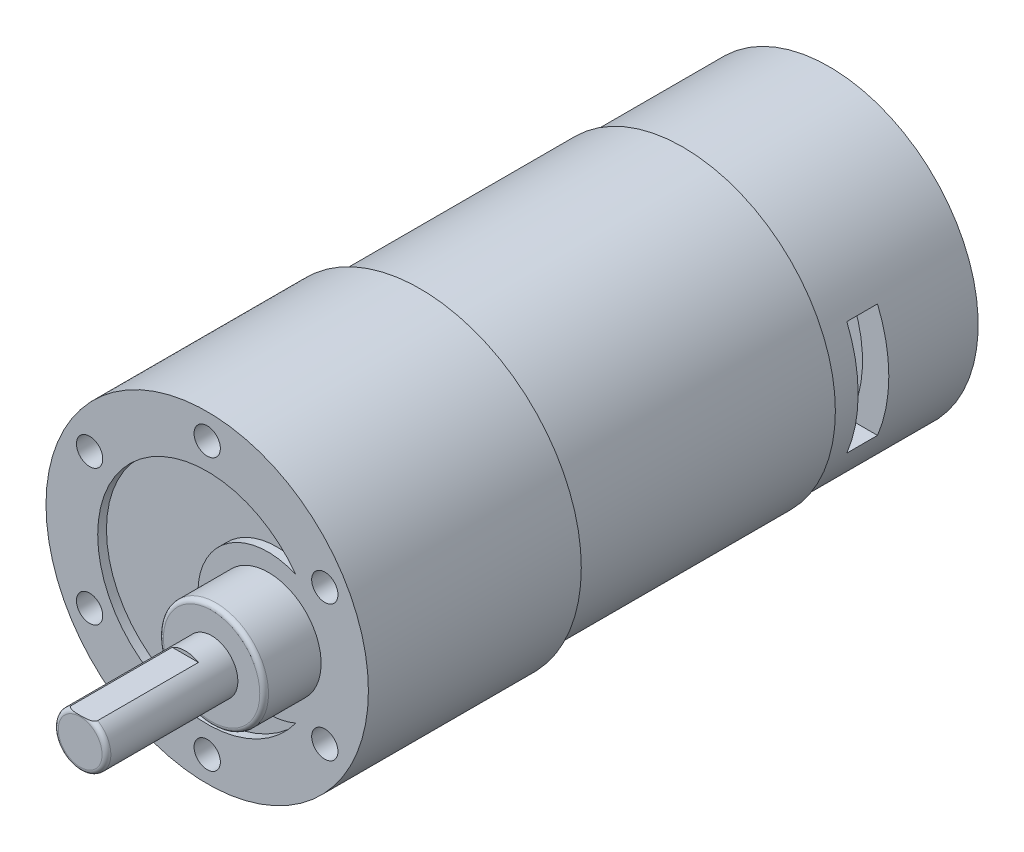
from build123d import *

# Parameters (mm, degrees)
SKETCH1_R                    = 18.4
BOSS_EXTRUDE1_DEPTH          = 24.3
SKETCH2_R                    = 17.4
BOSS_EXTRUDE2_DEPTH          = 30
SKETCH3_R                    = 6
BOSS_EXTRUDE3_DEPTH          = 6.5
FILLET1_R                    = 0.5
SKETCH4_R                    = 3
BOSS_EXTRUDE4_DEPTH          = 15
CUT_EXTRUDE1_START           = -12
CUT_EXTRUDE1_DEPTH           = 12
F_3_0_3_DIAMETER_HOLE1_D     = 3
F_3_0_3_DIAMETER_HOLE1_DEPTH = 3
F_3_0_3_DIAMETER_HOLE1_TIP   = 0.901290929
CUT_EXTRUDE2_DEPTH           = 1
SKETCH9_R                    = 4
BOSS_EXTRUDE5_DEPTH          = 1
FILLET2_R                    = 0.5
SKETCH10_R                   = 14
BOSS_EXTRUDE6_DEPTH          = 1.5
SKETCH11_W                   = 3.5
SKETCH11_H                   = 1
BOSS_EXTRUDE7_DEPTH          = 5.6
FILLET3_R                    = 0.5
SKETCH13_R                   = 9
BOSS_EXTRUDE8_DEPTH          = 3
SKETCH14_R                   = 1.5
BOSS_EXTRUDE9_DEPTH          = 8.55
FILLET4_R                    = 0.5
SKETCH15_W                   = 3
SKETCH15_H                   = 16.7
SKETCH16_R                   = 14
BOSS_EXTRUDE10_DEPTH         = 1
CUT_EXTRUDE3_START           = 12
SKETCH17_W                   = 3.5
SKETCH17_H                   = 13
CUT_EXTRUDE3_DEPTH           = 42.460359146


with BuildPart() as part:
    # Sketch1 → Boss-Extrude1 (new body)
    with BuildSketch(Plane.XY):
        Circle(SKETCH1_R)
    extrude(amount=BOSS_EXTRUDE1_DEPTH)

    # Sketch2 → Boss-Extrude2 (add)
    with BuildSketch(Plane(origin=(0, 0, 0), x_dir=(-1, 0, 0), z_dir=(0, 0, -1))):
        with Locations(Location((0, 0, 0), (0, 0, 180))):
            Circle(SKETCH2_R)
    extrude(amount=BOSS_EXTRUDE2_DEPTH)

    # Sketch3 → Boss-Extrude3 (add)
    with BuildSketch(Plane.XY.offset(24.3)):
        with Locations(Location((7, 0, 0), (0, 0, 180))):
            Circle(SKETCH3_R)
    extrude(amount=BOSS_EXTRUDE3_DEPTH)

    # Fillet1
    fillet1_edges = [part.edges().sort_by_distance(p)[0] for p in [
        (13, 0, 30.8),
    ]]
    fillet(fillet1_edges, radius=FILLET1_R)

    # Sketch4 → Boss-Extrude4 (add)
    with BuildSketch(Plane.XY.offset(30.8)):
        with Locations((7, 0)):
            Circle(SKETCH4_R)
    extrude(amount=BOSS_EXTRUDE4_DEPTH)

    # Sketch5 → Cut-Extrude1 (cut)
    with BuildSketch(Plane.XY.offset(45.8).offset(CUT_EXTRUDE1_START)):
        with BuildLine():
            Line((5.503337045, 2.6), (8.496662955, 2.6))
            ThreePointArc((8.496662955, 2.6), (7, 3), (5.503337045, 2.6))
        make_face()
    extrude(amount=CUT_EXTRUDE1_DEPTH, mode=Mode.SUBTRACT)

    # Ø3.0 (3) Diameter Hole1
    with Locations(Plane.XY.offset(24.3)):
        with Locations((-13.423393759, 7.75), (-13.423393759, -7.75), (0, -15.5), (13.423393759, 7.75), (0, 15.5), (13.423393759, -7.75)):
            Hole(F_3_0_3_DIAMETER_HOLE1_D / 2, depth=F_3_0_3_DIAMETER_HOLE1_DEPTH)
            with Locations((0, 0, -(F_3_0_3_DIAMETER_HOLE1_DEPTH + F_3_0_3_DIAMETER_HOLE1_TIP / 2))):  # 118° drill point
                Cone(0, F_3_0_3_DIAMETER_HOLE1_D / 2, F_3_0_3_DIAMETER_HOLE1_TIP, mode=Mode.SUBTRACT)

    # Sketch8 → Cut-Extrude2 (cut)
    with BuildSketch(Plane.XY.offset(24.3)):
        with BuildLine():
            ThreePointArc((10.116155685, 7.342574083), (-12.5, 0), (10.116155685, -7.342574083))
            ThreePointArc((10.116155685, -7.342574083), (-1.05978604, 0), (10.116155685, 7.342574083))
        make_face()
    extrude(amount=-CUT_EXTRUDE2_DEPTH, mode=Mode.SUBTRACT)

    # Sketch9 → Boss-Extrude5 (add)
    with BuildSketch(Plane(origin=(0, 0, -30), x_dir=(-1, 0, 0), z_dir=(0, 0, -1))):
        Circle(SKETCH9_R)
    extrude(amount=BOSS_EXTRUDE5_DEPTH)

    # Fillet2
    fillet2_edges = [part.edges().sort_by_distance(p)[0] for p in [
        (4, 0, -31),
    ]]
    fillet(fillet2_edges, radius=FILLET2_R)

    # Sketch11 → Boss-Extrude7 (add)
    with BuildSketch(Plane(origin=(0, 0, -30), x_dir=(-1, 0, 0), z_dir=(0, 0, -1))):
        with Locations((0, 12.05)):
            Rectangle(SKETCH11_W, SKETCH11_H)
        with Locations((0, -12.05)):
            Rectangle(SKETCH11_W, SKETCH11_H)
    extrude(amount=BOSS_EXTRUDE7_DEPTH)

    # Fillet3
    fillet3_edges = [part.edges().sort_by_distance(p)[0] for p in [
        (1.75, 12.05, -35.6),
        (-1.75, 12.05, -35.6),
        (-1.75, -12.05, -35.6),
        (1.75, -12.05, -35.6),
    ]]
    fillet(fillet3_edges, radius=FILLET3_R)

    # Sketch14 → Boss-Extrude9 (add)
    with BuildSketch(Plane(origin=(0, 0, -31), x_dir=(-1, 0, 0), z_dir=(0, 0, -1))):
        Circle(SKETCH14_R)
    extrude(amount=BOSS_EXTRUDE9_DEPTH)

    # Fillet4
    # the kernel refuses this fillet: 0.5 mm, written as the material it takes off along each edge
    with BuildSketch(Plane(origin=(7, 0, 45.8), x_dir=(0.4622655728594592, 0.8867415295050277, 0), z_dir=(0.8867415295050277, -0.4622655728594592, 0))) as fillet4_piece_1:
        with BuildLine():
            CenterArc((3 - FILLET4_R, -FILLET4_R), FILLET4_R, 0, 90)
            Line((3 - FILLET4_R, 0), (3 - FILLET4_R, FILLET4_R * 0.02))
            Line((3 - FILLET4_R, FILLET4_R * 0.02), (3 + FILLET4_R * 0.02, FILLET4_R * 0.02))
            Line((3 + FILLET4_R * 0.02, FILLET4_R * 0.02), (3 + FILLET4_R * 0.02, -FILLET4_R))
            Line((3 + FILLET4_R * 0.02, -FILLET4_R), (3, -FILLET4_R))
        make_face()
    revolve(axis=Axis((7, 0, 45.8), (0, 0, 1)), revolution_arc=297.533397677, mode=Mode.SUBTRACT)
    with BuildSketch(Plane(origin=(7, 0, 45.8), x_dir=(1, 0, 0), z_dir=(0, -1, 0))) as fillet4_piece_2:
        with BuildLine():
            CenterArc((3 - FILLET4_R, -FILLET4_R), FILLET4_R, 0, 90)
            Line((3 - FILLET4_R, 0), (3 - FILLET4_R, FILLET4_R * 0.02))
            Line((3 - FILLET4_R, FILLET4_R * 0.02), (3 + FILLET4_R * 0.02, FILLET4_R * 0.02))
            Line((3 + FILLET4_R * 0.02, FILLET4_R * 0.02), (3 + FILLET4_R * 0.02, -FILLET4_R))
            Line((3 + FILLET4_R * 0.02, -FILLET4_R), (3, -FILLET4_R))
        make_face()
    revolve(axis=Axis((7, 0, 45.8), (0, 0, 1)), revolution_arc=117.379597562, mode=Mode.SUBTRACT)


with BuildPart() as body_2:
    # Sketch10 → Boss-Extrude6 (new body)
    with BuildSketch(Plane(origin=(0, 0, -33), x_dir=(-1, 0, 0), z_dir=(0, 0, -1))):
        Circle(SKETCH10_R)
    extrude(amount=BOSS_EXTRUDE6_DEPTH)


    add(part.part)  # Revolve1 merges part


with BuildPart() as body_3:
    # Sketch13 → Boss-Extrude8 (new body)
    with BuildSketch(Plane(origin=(0, 0, -36.5), x_dir=(-1, 0, 0), z_dir=(0, 0, -1))):
        Circle(SKETCH13_R)
    extrude(amount=BOSS_EXTRUDE8_DEPTH)


with BuildPart() as body_2_1:
    add(body_2.part)

    add(body_3.part)  # Revolve1 merges body 3
    # Sketch15 → Revolve1 (revolve)
    with BuildSketch(Plane(origin=(0, 0, 0), x_dir=(1, 0, 0), z_dir=(0, 1, 0))):
        with Locations((-15.5, 38.35)):
            Rectangle(SKETCH15_W, SKETCH15_H)
    revolve(axis=Axis((0, 0, -30), (0, 0, 1)))

    # Sketch16 → Boss-Extrude10 (add)
    with BuildSketch(Plane(origin=(0, 0, -46.7), x_dir=(-1, 0, 0), z_dir=(0, 0, -1))):
        Circle(SKETCH16_R)
    extrude(amount=-BOSS_EXTRUDE10_DEPTH)

    # Sketch17 → Cut-Extrude3 (cut, through all)
    with BuildSketch(Plane(origin=(0, 0, 0), x_dir=(0, 0, -1), z_dir=(1, 0, 0)).offset(CUT_EXTRUDE3_START)):
        with Locations((34.75, 0)):
            Rectangle(SKETCH17_W, SKETCH17_H)
    extrude(amount=CUT_EXTRUDE3_DEPTH, mode=Mode.SUBTRACT)


solid = body_2_1.part
